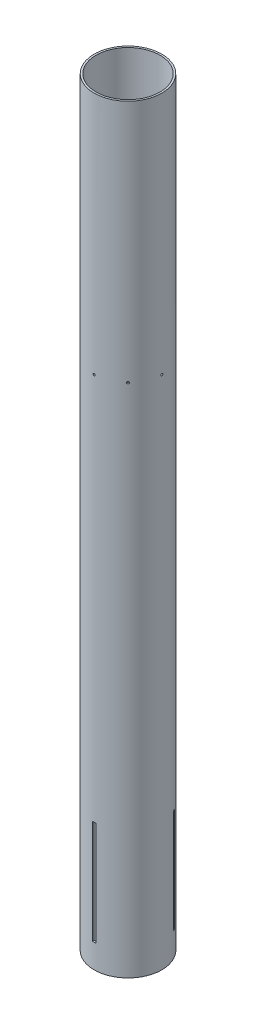
from build123d import *

# Parameters (mm, degrees)
SKETCH1_R                 = 53.721
SKETCH1_R_2               = 50.8
BODY_TUBE_EXTRUSION_DEPTH = 1206.5
ENGINE_BLOCK_HOLE_REACH   = 1214.465
SKETCH2_R                 = 1.6383
CIRPATTERN1_COUNT         = 8
SKETCH3_W                 = 5.334
SKETCH3_H                 = 165.1
FIN_TAB_SLOTS_DEPTH       = 2.54
CIRPATTERN2_COUNT         = 3


with BuildPart() as part:
    # Sketch1 → Body Tube Extrusion (new body)
    with BuildSketch(Plane(origin=(0, 0, 0), x_dir=(1, 0, 0), z_dir=(0, 1, 0))):
        Circle(SKETCH1_R)
        Circle(SKETCH1_R_2, mode=Mode.SUBTRACT)
    extrude(amount=BODY_TUBE_EXTRUSION_DEPTH)

    # Sketch2 → Engine Block Hole (cut, up to next)
    with BuildSketch(Plane.XY.offset(53.721), mode=Mode.PRIVATE) as engine_block_hole_sk1:
        with Locations((0, 819.15)):
            Circle(SKETCH2_R)
    engine_block_hole_tool1 = extrude(engine_block_hole_sk1.sketch, amount=-ENGINE_BLOCK_HOLE_REACH, mode=Mode.PRIVATE) & part.part
    engine_block_hole = engine_block_hole_tool1.solids().sort_by_distance((0, 819.15, 53.721))[0]
    add(engine_block_hole, mode=Mode.SUBTRACT)

    # CirPattern1: Engine Block Hole ×8 about axis
    cirpattern1_axis = Axis((0, 1206.5, 0), (0, -1, 0))
    for i in range(1, CIRPATTERN1_COUNT):
        add(engine_block_hole.rotate(cirpattern1_axis, i * 360 / CIRPATTERN1_COUNT), mode=Mode.SUBTRACT)

    # Sketch3 → Fin Tab Slots (cut)
    with BuildSketch(Plane.XY.offset(53.721)):
        with Locations((0, 120.65)):
            Rectangle(SKETCH3_W, SKETCH3_H)
    fin_tab_slots = extrude(amount=-FIN_TAB_SLOTS_DEPTH, mode=Mode.SUBTRACT)

    # CirPattern2: Fin Tab Slots ×3 about axis
    cirpattern2_axis = Axis((0, 1206.5, 0), (0, -1, 0))
    for i in range(1, CIRPATTERN2_COUNT):
        add(fin_tab_slots.rotate(cirpattern2_axis, i * 360 / CIRPATTERN2_COUNT), mode=Mode.SUBTRACT)


solid = part.part
